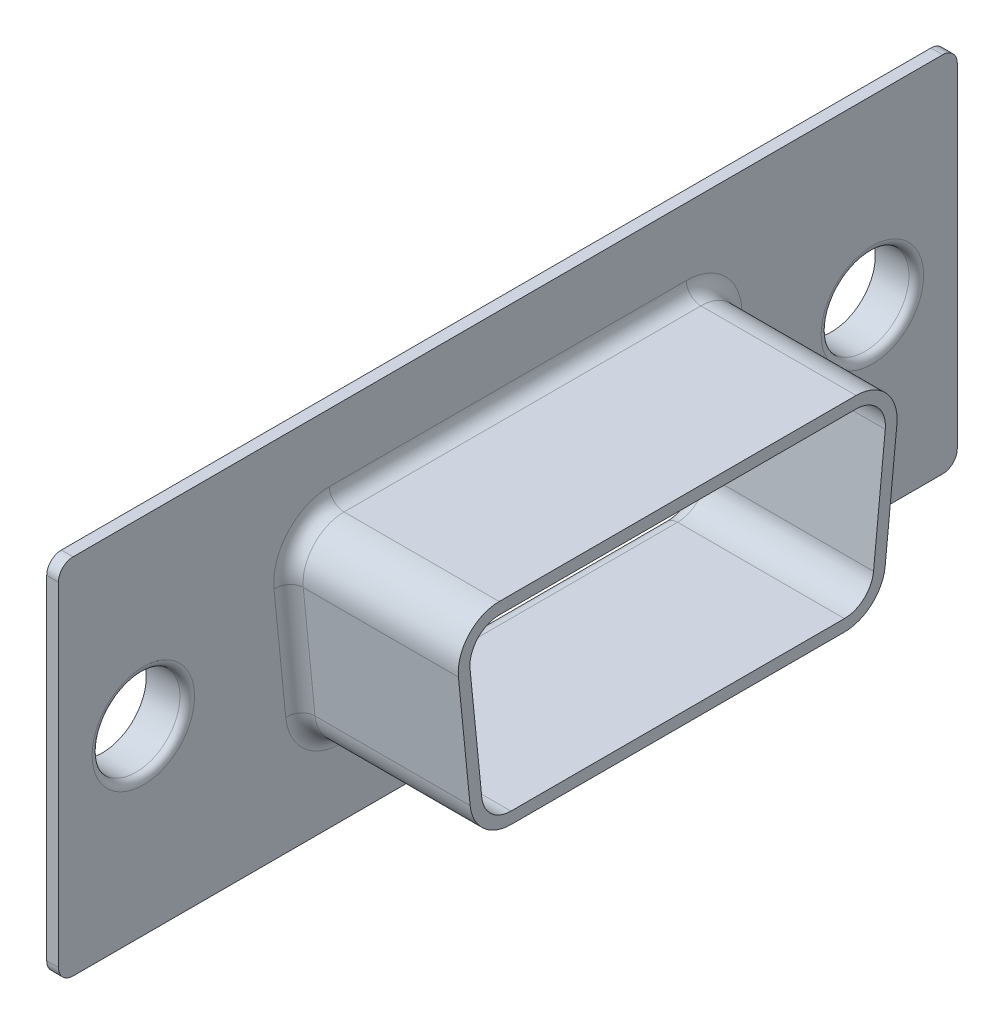
from build123d import *
from OCP.BRepAlgoAPI import BRepAlgoAPI_Cut
from OCP.TopTools import TopTools_ListOfShape

# Parameters (mm, degrees)
SM_BASE_FLANGE_2_DEPTH = 5.8
SKETCH_10_W            = 30.7
SKETCH_10_H            = 12.4
EXTRUDE_1_DEPTH        = 0.4
CUT_EXTRUDE_1_DEPTH    = 18.541450909
FILLET_1_R             = 0.5
SKETCH_13_R            = 1.5
CUT_EXTRUDE_2_DEPTH    = 18.541451065
FILLET_2_R             = 0.5
SKETCH_15_R            = 1.6
SKETCH_15_R_2          = 1.5
EXTRUDE_2_DEPTH        = 1
FILLET_3_R             = 0.25
FILLET_4_R             = 0.25


# Sheet-metal steps are written as plain solids
with BuildPart() as part:
    # 基体-法兰2: sheet metal written as solids
    # 草图1 → 基体-法兰2 (new body)
    with BuildSketch(Plane(origin=(0, 0, 0), x_dir=(0, 0, -1), z_dir=(1, 0, 0))):
        with BuildLine():
            Line((-6.095012438, 3.4), (6.095012438, 3.4))
            ThreePointArc((6.095012438, 3.4), (7.133045985, 2.939407449), (7.488064504, 1.860694793))
            Line((7.488064504, 1.860694793), (7.088064504, -2.139305207))
            ThreePointArc((7.088064504, -2.139305207), (6.634419887, -3.038033547), (5.695012438, -3.4))
            Line((5.695012438, -3.4), (-5.695012438, -3.4))
            ThreePointArc((-5.695012438, -3.4), (-6.634419887, -3.038033547), (-7.088064504, -2.139305207))
            Line((-7.088064504, -2.139305207), (-7.488064504, 1.860694793))
            ThreePointArc((-7.488064504, 1.860694793), (-7.133045985, 2.939407449), (-6.095012438, 3.4))
        make_face()
        with BuildLine():
            Line((-6.095012438, 3), (6.095012438, 3))
            ThreePointArc((6.095012438, 3), (6.836464971, 2.671005321), (7.090049628, 1.900496281))
            Line((7.090049628, 1.900496281), (6.690049628, -2.099503719))
            ThreePointArc((6.690049628, -2.099503719), (6.366017759, -2.741452534), (5.695012438, -3))
            Line((5.695012438, -3), (-5.695012438, -3))
            ThreePointArc((-5.695012438, -3), (-6.366017759, -2.741452534), (-6.690049628, -2.099503719))
            Line((-6.690049628, -2.099503719), (-7.090049628, 1.900496281))
            ThreePointArc((-7.090049628, 1.900496281), (-6.836464971, 2.671005321), (-6.095012438, 3))
        make_face(mode=Mode.SUBTRACT)
    extrude(amount=-SM_BASE_FLANGE_2_DEPTH)

    # 草图10 → 凸台-拉伸1 (add)
    with BuildSketch(Plane.ZY.offset(5.8)):
        Rectangle(SKETCH_10_W, SKETCH_10_H)
    extrude(amount=EXTRUDE_1_DEPTH)


with BuildPart() as cut_extrude_1_tool:
    # 草图11 → 切除-拉伸1 (new, through all)
    with BuildSketch(Plane(origin=(-5.8, 0, 0), x_dir=(0, 0, -1), z_dir=(1, 0, 0))):
        with BuildLine():
            Line((-7.085301548, 1.901695099), (-6.690168051, -2.098304901))
            ThreePointArc((-6.690168051, -2.098304901), (-6.366463531, -2.741048211), (-5.695011709, -3))
            Line((-5.695011709, -3), (5.695012438, -3))
            ThreePointArc((5.695012438, -3), (6.366017759, -2.741452534), (6.690049628, -2.099503719))
            Line((6.690049628, -2.099503719), (7.090049628, 1.900496281))
            ThreePointArc((7.090049628, 1.900496281), (6.836464971, 2.671005321), (6.095012438, 3))
            Line((6.095012438, 3), (-6.090145205, 3))
            ThreePointArc((-6.090145205, 3), (-6.831193416, 2.671451822), (-7.085301548, 1.901695099))
        make_face()
    extrude(amount=-CUT_EXTRUDE_1_DEPTH)


with BuildPart() as part_1:
    add(part.part)

    # 切除-拉伸1: cut by cut_extrude_1_tool, with a tolerance
    cut_extrude_1_stock = TopTools_ListOfShape()
    cut_extrude_1_stock.Append(part_1.part.wrapped)
    cut_extrude_1_tools = TopTools_ListOfShape()
    cut_extrude_1_tools.Append(cut_extrude_1_tool.part.wrapped)
    cut_extrude_1_cut = BRepAlgoAPI_Cut()
    cut_extrude_1_cut.SetArguments(cut_extrude_1_stock)
    cut_extrude_1_cut.SetTools(cut_extrude_1_tools)
    cut_extrude_1_cut.SetFuzzyValue(0.00001)
    cut_extrude_1_cut.Build()
    add(Compound.cast(cut_extrude_1_cut.Shape()).solids(), mode=Mode.REPLACE)

    # 圆角1
    fillet_1_edges = [part_1.edges().sort_by_distance(p)[0] for p in [
        (-6.2, -2.741452534, -6.366017759),
        (-6.2, -3, -3.65e-07),
        (-6.2, -2.741048211, 6.366463531),
        (-6.2, -0.098304901, 6.8877348),
        (-6.2, 2.671451822, 6.831193416),
        (-6.2, 3, -0.002433616),
        (-6.2, 2.671005321, -6.836464971),
        (-5.8, -3.038033547, -6.634419887),
        (-5.8, -3.4, 0),
        (-5.8, -3.038033547, 6.634419887),
        (-5.8, -0.139305207, 7.288064504),
        (-5.8, 2.939407449, 7.133045985),
        (-5.8, 3.4, 0),
        (-5.8, 2.939407449, -7.133045985),
        (-6.2, -0.099503719, -6.890049628),
        (-5.8, -0.139305207, -7.288064504),
    ]]
    fillet(fillet_1_edges, radius=FILLET_1_R)

    # 草图13 → 切除-拉伸2 (cut, through all)
    with BuildSketch(Plane(origin=(-5.8, 0, 0), x_dir=(0, 0, -1), z_dir=(1, 0, 0))):
        with Locations((12.45, 0)):
            Circle(SKETCH_13_R)
        with Locations(Location((-12.45, 0, 0), (0, 0, 180))):
            Circle(SKETCH_13_R)
    extrude(amount=-CUT_EXTRUDE_2_DEPTH, mode=Mode.SUBTRACT)

    # 圆角2
    fillet_2_edges = [part_1.edges().sort_by_distance(p)[0] for p in [
        (-6, 6.2, -15.35),
        (-6, -6.2, -15.35),
        (-6, -6.2, 15.35),
        (-6, 6.2, 15.35),
    ]]
    fillet(fillet_2_edges, radius=FILLET_2_R)

    # 草图15 → 凸台-拉伸2 (add)
    with BuildSketch(Plane.ZY.offset(6.2)):
        with Locations((-12.45, 0)):
            Circle(SKETCH_15_R)
        with Locations(Location((-12.45, 0, 0), (0, 0, 180))):
            Circle(SKETCH_15_R_2, mode=Mode.SUBTRACT)
    extrude_2 = extrude(amount=EXTRUDE_2_DEPTH)

    # 圆角3
    fillet_3_edges = [part_1.edges().sort_by_distance(p)[0] for p in [
        (-5.8, 0, -10.95),
        (-6.2, 0, -14.05),
    ]]
    fillet(fillet_3_edges, radius=FILLET_3_R)

    # 镜向1: 凸台-拉伸2 across plane
    add(extrude_2.mirror(Plane.XY))

    # 圆角4
    fillet_4_edges = [part_1.edges().sort_by_distance(p)[0] for p in [
        (-5.8, 0, 10.95),
        (-6.2, 0, 14.05),
    ]]
    fillet(fillet_4_edges, radius=FILLET_4_R)


solid = part_1.part
